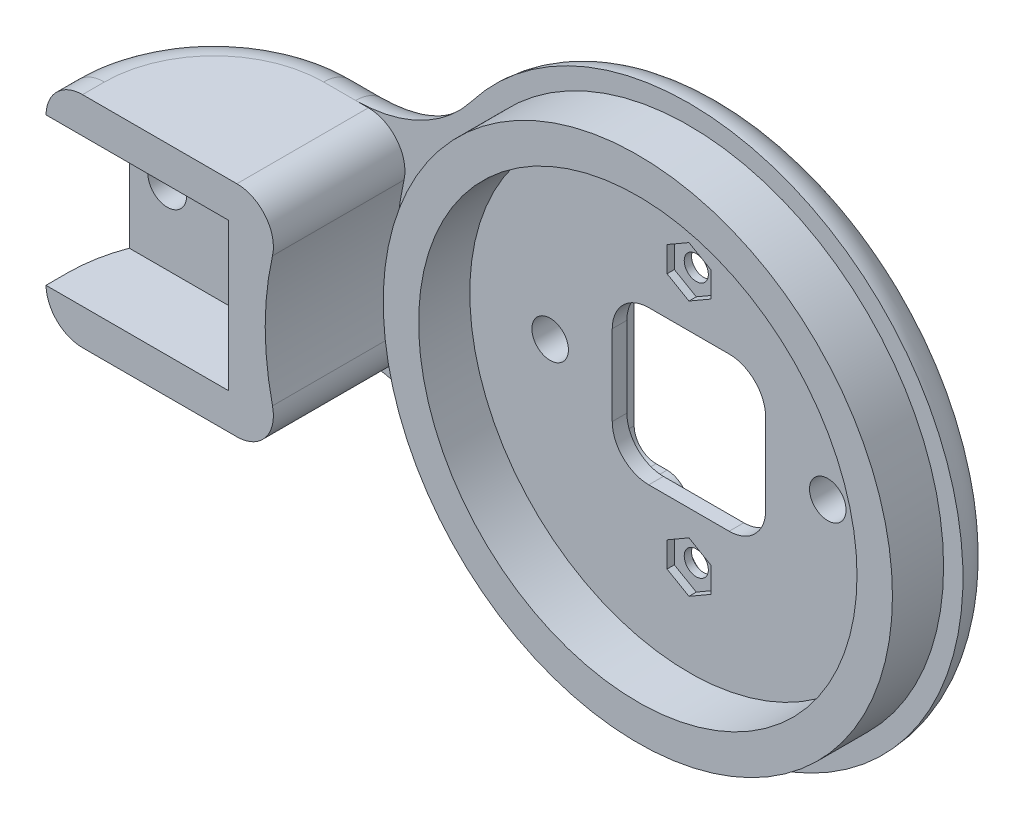
from build123d import *

# Parameters (mm, degrees)
BOSS_EXTRU_1_DEPTH       = 5
ESQUISSE6_R              = 34.85
ESQUISSE6_R_2            = 30
BOSS_EXTRU_6_DEPTH       = 7
BOSS_EXTRU_9_DEPTH       = 18
ENL_V_MAT_EXTRU_10_REACH = 84.676
ESQUISSE21_R             = 2.5
ESQUISSE22_R             = 4
ENL_V_MAT_EXTRU_11_DEPTH = 1
CONG_1_R                 = 20
CONG_2_R                 = 5
ESQUISSE11_W             = 20.2
ESQUISSE11_H             = 20.2
ENL_V_MAT_EXTRU_2_DEPTH  = 25
ESQUISSE12_R             = 2.65
ENL_V_MAT_EXTRU_3_DEPTH  = 81.451974996
ENL_V_START              = -5
ESQUISSE13_R             = 4.5
ENL_V_MAT_EXTRU_4_DEPTH  = 76.451974996
ENL_V_MAT_EXTRU_5_DEPTH  = 2
ENL_V_MAT_EXTRU_7_DEPTH  = 3
ESQUISSE19_R             = 1.65
ENL_V_MAT_EXTRU_8_DEPTH  = 82.890843677
ENL_V_MAT_EXTRU_9_DEPTH  = 1


with BuildPart() as part:
    # Esquisse1 → Boss.-Extru.1 (new body)
    with BuildSketch(Plane.XY):
        with BuildLine():
            Line((-45.620718977, 15), (-70, 15))
            Line((-70, 15), (-70, -15))
            Line((-70, -15), (-45.620718977, -15))
            ThreePointArc((-45.620718977, -15), (-36.774201608, -17.062911874), (-29.752642811, -22.826086957))
            ThreePointArc((-29.752642811, -22.826086957), (37.5, 0), (-29.752642811, 22.826086957))
            ThreePointArc((-29.752642811, 22.826086957), (-36.774201608, 17.062911874), (-45.620718977, 15))
        make_face()
    extrude(amount=BOSS_EXTRU_1_DEPTH)

    # Esquisse6 → Boss.-Extru.6 (add)
    with BuildSketch(Plane.XY.offset(5)):
        Circle(ESQUISSE6_R)
        Circle(ESQUISSE6_R_2, mode=Mode.SUBTRACT)
    extrude(amount=BOSS_EXTRU_6_DEPTH)

    # Esquisse8 → Boss.-Extru.9 (add)
    with BuildSketch(Plane.XY.offset(5)):
        with BuildLine():
            Line((-70, -15), (-70, 15))
            Line((-70, 15), (-43.874821937, 15))
            ThreePointArc((-43.874821937, 15), (-39.966142137, 13.118047822), (-38.999841722, 8.888888889))
            ThreePointArc((-38.999841722, 8.888888889), (-40, 0), (-38.999841722, -8.888888889))
            ThreePointArc((-38.999841722, -8.888888889), (-39.966142137, -13.118047822), (-43.874821937, -15))
            Line((-43.874821937, -15), (-70, -15))
        make_face()
    extrude(amount=BOSS_EXTRU_9_DEPTH)

    # Esquisse21 → Enlèv. mat.-Extru.10 (cut, up to next)
    with BuildSketch(Plane(origin=(0, 0, 0), x_dir=(-1, 0, 0), z_dir=(0, 0, -1)), mode=Mode.PRIVATE) as enl_v_mat_extru_10_sk1:
        with Locations((-19, 0)):
            Circle(ESQUISSE21_R)
    enl_v_mat_extru_10_tool1 = extrude(enl_v_mat_extru_10_sk1.sketch, amount=-ENL_V_MAT_EXTRU_10_REACH, mode=Mode.PRIVATE) & part.part
    # Esquisse21 → Enlèv. mat.-Extru.10 (cut, up to next)
    with BuildSketch(Plane(origin=(0, 0, 0), x_dir=(-1, 0, 0), z_dir=(0, 0, -1)), mode=Mode.PRIVATE) as enl_v_mat_extru_10_sk2:
        with Locations((19, 0)):
            Circle(ESQUISSE21_R)
    enl_v_mat_extru_10_tool2 = extrude(enl_v_mat_extru_10_sk2.sketch, amount=-ENL_V_MAT_EXTRU_10_REACH, mode=Mode.PRIVATE) & part.part
    add(enl_v_mat_extru_10_tool1.solids().sort_by_distance((19, 0, 0))[0], mode=Mode.SUBTRACT)
    add(enl_v_mat_extru_10_tool2.solids().sort_by_distance((-19, 0, 0))[0], mode=Mode.SUBTRACT)

    # Esquisse22 → Enlèv. mat.-Extru.11 (cut)
    with BuildSketch(Plane(origin=(0, 0, 0), x_dir=(-1, 0, 0), z_dir=(0, 0, -1))):
        with Locations((-19, 0)):
            Circle(ESQUISSE22_R)
        with Locations((19, 0)):
            Circle(ESQUISSE22_R)
    extrude(amount=-ENL_V_MAT_EXTRU_11_DEPTH, mode=Mode.SUBTRACT)

    # Congé1
    cong_1_edges = [part.edges().sort_by_distance(p)[0] for p in [
        (-70, 0, 0),
    ]]
    fillet(cong_1_edges, radius=CONG_1_R)

    # Congé2
    cong_2_edges = [part.edges().sort_by_distance(p)[0] for p in [
        (-47.810359489, -15, 0),
        (-36.774201608, -17.062911874, 0),
        (37.5, 0, 0),
        (-36.774201608, 17.062911874, 0),
        (-47.810359489, 15, 0),
        (-64.142135624, 15, 5.857864376),
        (-64.142135624, -15, 5.857864376),
        (-70, -15, 21.5),
        (-70, 15, 21.5),
    ]]
    fillet(cong_2_edges, radius=CONG_2_R - 0.0001)  # a hair under: the kernel refuses the full size

    # Esquisse11 → Enlèv. mat.-Extru.2 (cut)
    with BuildSketch(Plane.ZY.offset(70)):
        with Locations((23, 0)):
            Rectangle(ESQUISSE11_W, ESQUISSE11_H)
    extrude(amount=-ENL_V_MAT_EXTRU_2_DEPTH, mode=Mode.SUBTRACT)

    # Esquisse12 → Enlèv. mat.-Extru.3 (cut, through all)
    with BuildSketch(Plane.XY.offset(12.9)):
        with Locations((-51.5, 0)):
            Circle(ESQUISSE12_R)
        with Locations((-63.5, 0)):
            Circle(ESQUISSE12_R)
    extrude(amount=-ENL_V_MAT_EXTRU_3_DEPTH, mode=Mode.SUBTRACT)

    # Esquisse13 → Enlèv. mat.-Extru.4 (cut, through all)
    with BuildSketch(Plane.XY.offset(12.9).offset(ENL_V_START)):
        with Locations((-51.5, 0)):
            Circle(ESQUISSE13_R)
        with Locations((-63.5, 0)):
            Circle(ESQUISSE13_R)
    extrude(amount=-ENL_V_MAT_EXTRU_4_DEPTH, mode=Mode.SUBTRACT)

    # Esquisse14 → Enlèv. mat.-Extru.5 (cut)
    with BuildSketch(Plane.XY.offset(5)):
        with BuildLine():
            Line((-5.5, 10.5), (5.5, 10.5))
            ThreePointArc((5.5, 10.5), (9.035533906, 9.035533906), (10.5, 5.5))
            Line((10.5, 5.5), (10.5, -5.5))
            ThreePointArc((10.5, -5.5), (9.035533906, -9.035533906), (5.5, -10.5))
            Line((5.5, -10.5), (-5.5, -10.5))
            ThreePointArc((-5.5, -10.5), (-9.035533906, -9.035533906), (-10.5, -5.5))
            Line((-10.5, -5.5), (-10.5, 5.5))
            ThreePointArc((-10.5, 5.5), (-9.035533906, 9.035533906), (-5.5, 10.5))
        make_face()
    extrude(amount=-ENL_V_MAT_EXTRU_5_DEPTH, mode=Mode.SUBTRACT)

    # Esquisse17 → Enlèv. mat.-Extru.7 (cut)
    with BuildSketch(Plane(origin=(0, 0, 0), x_dir=(-1, 0, 0), z_dir=(0, 0, -1))):
        with BuildLine():
            Line((-5, -19.5), (-5, -15.5))
            ThreePointArc((-5, -15.5), (-5.878679656, -13.378679656), (-8, -12.5))
            Line((-8, -12.5), (-9.5, -12.5))
            ThreePointArc((-9.5, -12.5), (-11.621320344, -11.621320344), (-12.5, -9.5))
            Line((-12.5, -9.5), (-12.5, 9.5))
            ThreePointArc((-12.5, 9.5), (-11.621320344, 11.621320344), (-9.5, 12.5))
            Line((-9.5, 12.5), (-8, 12.5))
            ThreePointArc((-8, 12.5), (-5.878679656, 13.378679656), (-5, 15.5))
            Line((-5, 15.5), (-5, 19.5))
            ThreePointArc((-5, 19.5), (-4.121320344, 21.621320344), (-2, 22.5))
            Line((-2, 22.5), (2, 22.5))
            ThreePointArc((2, 22.5), (4.121320344, 21.621320344), (5, 19.5))
            Line((5, 19.5), (5, 15.5))
            ThreePointArc((5, 15.5), (5.878679656, 13.378679656), (8, 12.5))
            Line((8, 12.5), (9.5, 12.5))
            ThreePointArc((9.5, 12.5), (11.621320344, 11.621320344), (12.5, 9.5))
            Line((12.5, 9.5), (12.5, -9.5))
            ThreePointArc((12.5, -9.5), (11.621320344, -11.621320344), (9.5, -12.5))
            Line((9.5, -12.5), (8, -12.5))
            ThreePointArc((8, -12.5), (5.878679656, -13.378679656), (5, -15.5))
            Line((5, -15.5), (5, -19.5))
            ThreePointArc((5, -19.5), (4.121320344, -21.621320344), (2, -22.5))
            Line((2, -22.5), (-2, -22.5))
            ThreePointArc((-2, -22.5), (-4.121320344, -21.621320344), (-5, -19.5))
        make_face()
    extrude(amount=-ENL_V_MAT_EXTRU_7_DEPTH, mode=Mode.SUBTRACT)

    # Esquisse19 → Enlèv. mat.-Extru.8 (cut, through all)
    with BuildSketch(Plane(origin=(0, 0, 3), x_dir=(-1, 0, 0), z_dir=(0, 0, -1))):
        with Locations((0, 17.5)):
            Circle(ESQUISSE19_R)
        with Locations((0, -17.5)):
            Circle(ESQUISSE19_R)
    extrude(amount=-ENL_V_MAT_EXTRU_8_DEPTH, mode=Mode.SUBTRACT)

    # Esquisse20 → Enlèv. mat.-Extru.9 (cut)
    with BuildSketch(Plane.XY.offset(5)):
        Polygon((0, -14.035898385), (-3, -15.767949192), (-3, -19.232050808), (0, -20.964101615), (3, -19.232050808), (3, -15.767949192), align=None)
        Polygon((0, 14.035898385), (3, 15.767949192), (3, 19.232050808), (0, 20.964101615), (-3, 19.232050808), (-3, 15.767949192), align=None)
    extrude(amount=-ENL_V_MAT_EXTRU_9_DEPTH, mode=Mode.SUBTRACT)


solid = part.part
